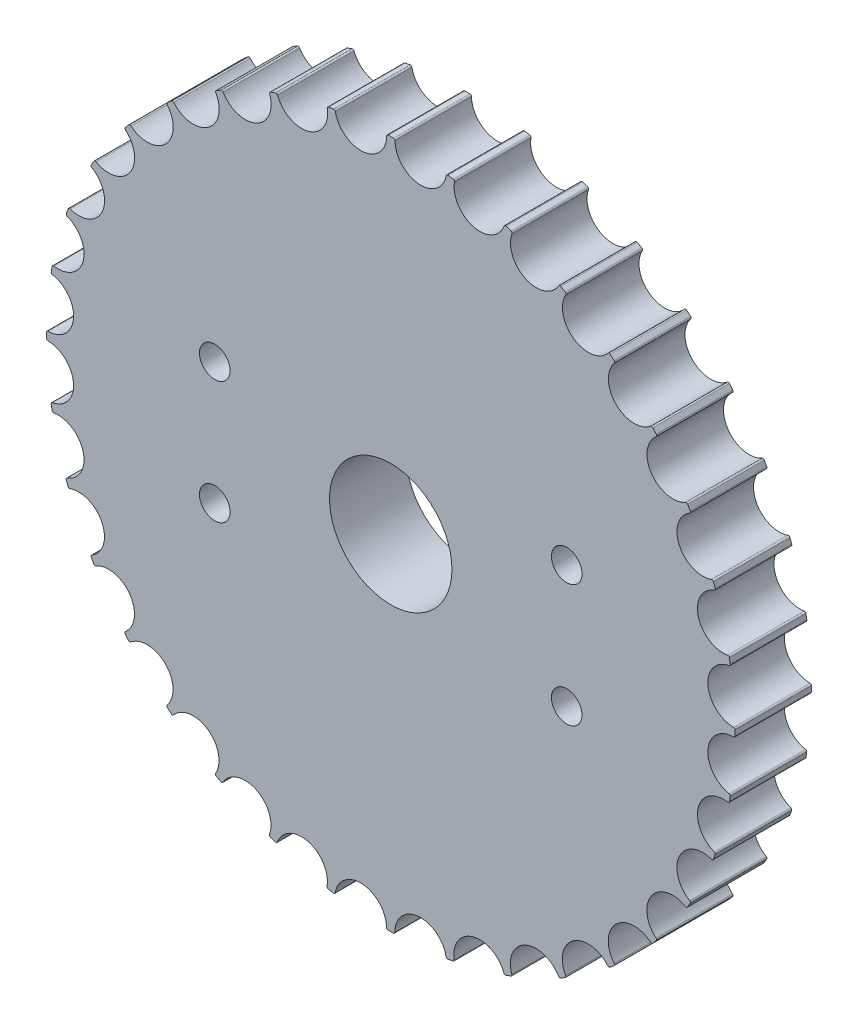
from build123d import *

# Parameters (mm, degrees)
SKETCH_1_R          = 45
EXTRUDE_1_DEPTH     = 10
SKETCH_2_R          = 3.38
CUT_EXTRUDE_2_DEPTH = 50
FILLET_1_R          = 0.2
SKETCH_4_R          = 8
CUT_EXTRUDE_3_DEPTH = 10
SKETCH_5_R          = 2
CUT_EXTRUDE_4_DEPTH = 10


with BuildPart() as part:
    # 스케치1 → 보스-돌출1 (new body)
    with BuildSketch(Plane.XY):
        Circle(SKETCH_1_R)
    extrude(amount=EXTRUDE_1_DEPTH)

    # 스케치2 → 컷-돌출2 (cut)
    with BuildSketch(Plane.XY.offset(10)):
        with Locations((3.93571055, 44.827560523)):
            Circle(SKETCH_2_R)
        with Locations((11.660142457, 43.463100187)):
            Circle(SKETCH_2_R)
        with Locations((19.030286837, 40.778035545)):
            Circle(SKETCH_2_R)
        with Locations((25.82220558, 36.853950928)):
            Circle(SKETCH_2_R)
        with Locations((31.829529673, 31.81007766)):
            Circle(SKETCH_2_R)
        with Locations((36.869729614, 25.79967128)):
            Circle(SKETCH_2_R)
        with Locations((40.789661478, 19.005354943)):
            Circle(SKETCH_2_R)
        with Locations((43.470220118, 11.633570514)):
            Circle(SKETCH_2_R)
        with Locations((44.829958117, 3.908305931)):
            Circle(SKETCH_2_R)
        with Locations((44.827560523, -3.93571055)):
            Circle(SKETCH_2_R)
        with Locations((43.463100187, -11.660142457)):
            Circle(SKETCH_2_R)
        with Locations((40.778035545, -19.030286837)):
            Circle(SKETCH_2_R)
        with Locations((36.853950928, -25.82220558)):
            Circle(SKETCH_2_R)
        with Locations((31.81007766, -31.829529673)):
            Circle(SKETCH_2_R)
        with Locations((25.79967128, -36.869729614)):
            Circle(SKETCH_2_R)
        with Locations((19.005354943, -40.789661478)):
            Circle(SKETCH_2_R)
        with Locations((11.633570514, -43.470220118)):
            Circle(SKETCH_2_R)
        with Locations((3.908305931, -44.829958117)):
            Circle(SKETCH_2_R)
        with Locations((-3.93571055, -44.827560523)):
            Circle(SKETCH_2_R)
        with Locations((-11.660142457, -43.463100187)):
            Circle(SKETCH_2_R)
        with Locations((-19.030286837, -40.778035545)):
            Circle(SKETCH_2_R)
        with Locations((-25.82220558, -36.853950928)):
            Circle(SKETCH_2_R)
        with Locations((-31.829529673, -31.81007766)):
            Circle(SKETCH_2_R)
        with Locations((-36.869729614, -25.79967128)):
            Circle(SKETCH_2_R)
        with Locations((-40.789661478, -19.005354943)):
            Circle(SKETCH_2_R)
        with Locations((-43.470220118, -11.633570514)):
            Circle(SKETCH_2_R)
        with Locations((-44.829958117, -3.908305931)):
            Circle(SKETCH_2_R)
        with Locations((-44.827560523, 3.93571055)):
            Circle(SKETCH_2_R)
        with Locations((-43.463100187, 11.660142457)):
            Circle(SKETCH_2_R)
        with Locations((-40.778035545, 19.030286837)):
            Circle(SKETCH_2_R)
        with Locations((-36.853950928, 25.82220558)):
            Circle(SKETCH_2_R)
        with Locations((-31.81007766, 31.829529673)):
            Circle(SKETCH_2_R)
        with Locations((-25.79967128, 36.869729614)):
            Circle(SKETCH_2_R)
        with Locations((-19.005354943, 40.789661478)):
            Circle(SKETCH_2_R)
        with Locations((-11.633570514, 43.470220118)):
            Circle(SKETCH_2_R)
        with Locations((-3.908305931, 44.829958117)):
            Circle(SKETCH_2_R)
    extrude(amount=-CUT_EXTRUDE_2_DEPTH, mode=Mode.SUBTRACT)

    # 필렛1
    fillet_1_edges = [part.edges().sort_by_distance(p)[0] for p in [
        (44.996516217, -0.559935976, 5),
        (44.996850108, 0.532428702, 5),
        (44.410149891, 7.262133752, 5),
        (44.220791574, 8.337960936, 5),
        (42.474403633, 14.863547221, 5),
        (42.101106664, 15.890148446, 5),
        (39.248094114, 22.013339329, 5),
        (38.702200933, 22.959521836, 5),
        (34.829251116, 28.49426726, 5),
        (34.127348411, 29.331281773, 5),
        (29.352138947, 34.1094113, 5),
        (28.515553676, 34.811825556, 5),
        (22.983176889, 38.688158138, 5),
        (22.037328273, 39.234629635, 5),
        (44.405702122, -7.289281108, 5),
        (44.215686168, -8.364992333, 5),
        (42.465309346, -14.889509801, 5),
        (42.091384868, -15.915882631, 5),
        (39.234629635, -22.037328273, 5),
        (38.688158138, -22.983176889, 5),
        (34.811825556, -28.515553676, 5),
        (34.1094113, -29.352138947, 5),
        (29.331281773, -34.127348411, 5),
        (28.49426726, -34.829251116, 5),
        (22.959521836, -38.702200933, 5),
        (22.013339329, -39.248094114, 5),
        (15.890148446, -42.101106664, 5),
        (14.863547221, -42.474403633, 5),
        (8.337960936, -44.220791574, 5),
        (7.262133752, -44.410149891, 5),
        (0.532428702, -44.996850108, 5),
        (-0.559935976, -44.996516217, 5),
        (-7.289281108, -44.405702122, 5),
        (-8.364992333, -44.215686168, 5),
        (-14.889509801, -42.465309346, 5),
        (-15.915882631, -42.091384868, 5),
        (-22.037328273, -39.234629635, 5),
        (-22.983176889, -38.688158138, 5),
        (-28.515553676, -34.811825556, 5),
        (-29.352138947, -34.1094113, 5),
        (-34.127348411, -29.331281773, 5),
        (-34.829251116, -28.49426726, 5),
        (-38.702200933, -22.959521836, 5),
        (-39.248094114, -22.013339329, 5),
        (-42.101106664, -15.890148446, 5),
        (-42.474403633, -14.863547221, 5),
        (-44.220791574, -8.337960936, 5),
        (-44.410149891, -7.262133752, 5),
        (-44.996850108, -0.532428702, 5),
        (-44.996516217, 0.559935976, 5),
        (-44.405702122, 7.289281108, 5),
        (-44.215686168, 8.364992333, 5),
        (-42.465309346, 14.889509801, 5),
        (-42.091384868, 15.915882631, 5),
        (-39.234629635, 22.037328273, 5),
        (-38.688158138, 22.983176889, 5),
        (-34.811825556, 28.515553676, 5),
        (-34.1094113, 29.352138947, 5),
        (-29.331281773, 34.127348411, 5),
        (-28.49426726, 34.829251116, 5),
        (-22.013339329, 39.248094114, 5),
        (-22.959521836, 38.702200933, 5),
        (-15.890148446, 42.101106664, 5),
        (-14.863547221, 42.474403633, 5),
        (-8.337960936, 44.220791574, 5),
        (-7.262133752, 44.410149891, 5),
        (-0.532428702, 44.996850108, 5),
        (0.559935976, 44.996516217, 5),
        (7.289281108, 44.405702122, 5),
        (8.364992333, 44.215686168, 5),
        (14.889509801, 42.465309346, 5),
        (15.915882631, 42.091384868, 5),
    ]]
    fillet(fillet_1_edges, radius=FILLET_1_R)

    # 스케치4 → 컷-돌출3 (cut)
    with BuildSketch(Plane.XY.offset(10)):
        Circle(SKETCH_4_R)
    extrude(amount=-CUT_EXTRUDE_3_DEPTH, mode=Mode.SUBTRACT)

    # 스케치5 → 컷-돌출4 (cut)
    with BuildSketch(Plane.XY.offset(10)):
        with Locations((-23, 8)):
            Circle(SKETCH_5_R)
        with Locations((23, 8)):
            Circle(SKETCH_5_R)
        with Locations((23, -8)):
            Circle(SKETCH_5_R)
        with Locations((-23, -8)):
            Circle(SKETCH_5_R)
    extrude(amount=-CUT_EXTRUDE_4_DEPTH, mode=Mode.SUBTRACT)


solid = part.part
